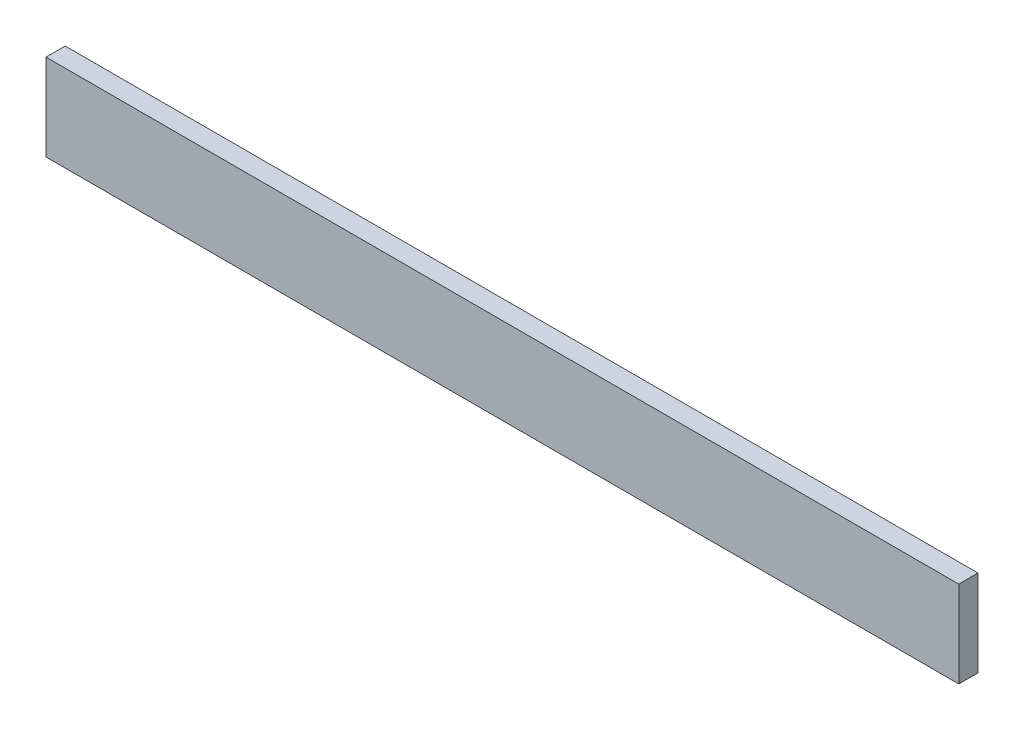
from build123d import *

# Parameters (mm, degrees)
BOSS_EXTRUDE1_DEPTH      = 10
BOSS_EXTRUDE1_DEPTH_BACK = 10
SKETCH1_W                = 950
SKETCH1_H                = 90


with BuildPart() as part:
    # Sketch1 → Boss-Extrude1 (new, two sides: drawn at the far end of the back side and taken through both)
    with BuildSketch(Plane.XY.offset(-BOSS_EXTRUDE1_DEPTH_BACK)):
        with Locations((-320.333333333, 0)):
            Rectangle(SKETCH1_W, SKETCH1_H)
    extrude(amount=BOSS_EXTRUDE1_DEPTH + BOSS_EXTRUDE1_DEPTH_BACK)


solid = part.part
